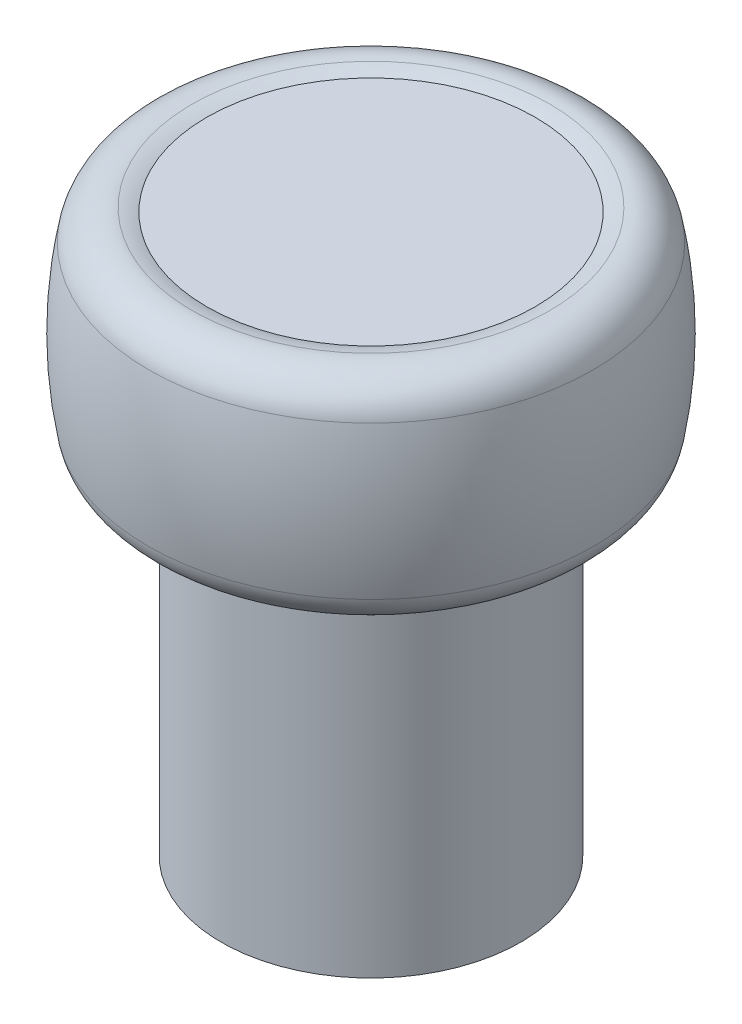
from build123d import *

# Parameters (mm, degrees)
ZAOBLIT1_R = 2.7


with BuildPart() as part:
    # Skica1 → Rotovat1 (revolve)
    with BuildSketch(Plane.XY):
        with BuildLine():
            Line((0, 0), (0, 40))
            Line((0, 40), (-11.78, 40))
            ThreePointArc((-11.78, 40), (-13.640287208, 40.357347759), (-15.5, 39.997022564))
            ThreePointArc((-15.5, 39.997022564), (-16.452624903, 32.497022564), (-15.5, 24.997022564))
            Line((-15.5, 24.997022564), (-10.75, 24.997022564))
            Line((-10.75, 24.997022564), (-10.75, 0))
            Line((-10.75, 0), (0, 0))
        make_face()
    revolve(axis=Axis((0, 0, 0), (0, 1, 0)))

    # Zaoblit1
    zaoblit1_edges = [part.edges().sort_by_distance(p)[0] for p in [
        (15.5, 39.997022564, 0),
        (15.5, 24.997022564, 0),
    ]]
    fillet(zaoblit1_edges, radius=ZAOBLIT1_R)


solid = part.part
